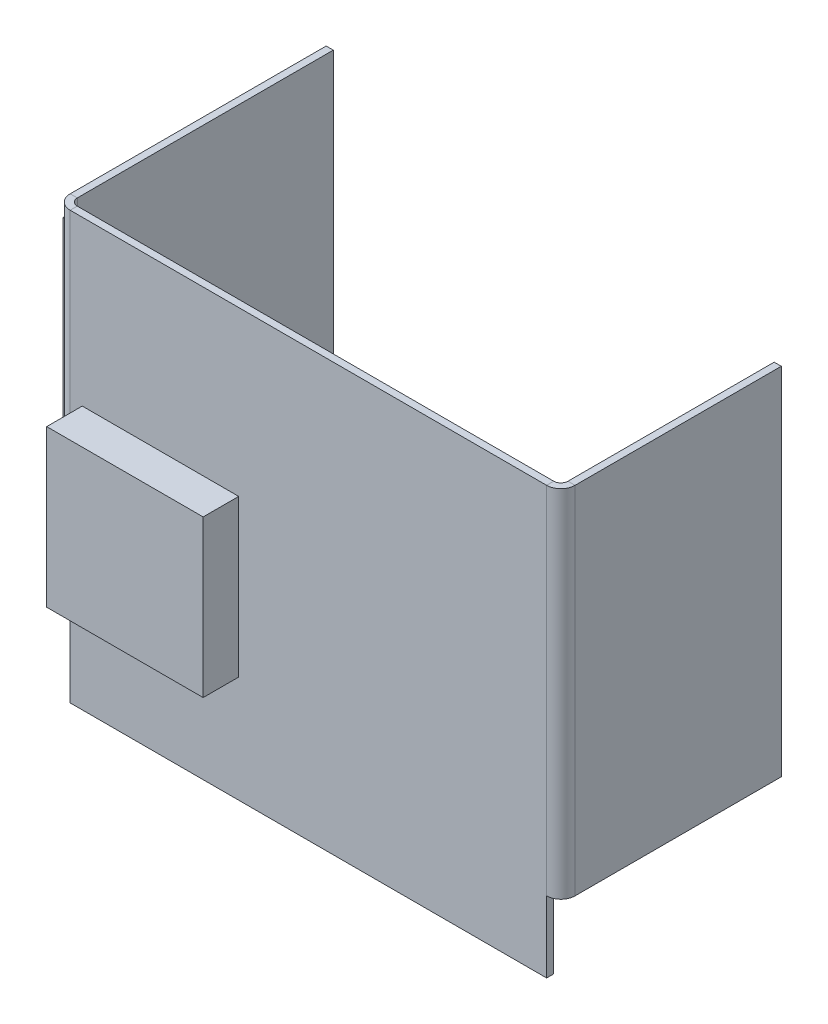
from build123d import *

# Parameters (mm, degrees)
BASE_FLANGE3_DEPTH  = 6
SKETCH14_W          = 0.2
SKETCH14_H          = 1
CUT_EXTRUDE1_DEPTH  = 10.97196069
SKETCH15_W          = 2.2
SKETCH15_H          = 2.2
BOSS_EXTRUDE1_DEPTH = 0.5
SKETCH16_W          = 3
SKETCH16_H          = 4.2
BOSS_EXTRUDE2_DEPTH = 0.5


# Sheet-metal steps are written as plain solids
with BuildPart() as part:
    # Sketch1 → Base-Flange3 (new body)
    with BuildSketch(Plane(origin=(0, 0, 0), x_dir=(1, 0, 0), z_dir=(0, 1, 0))):
        with BuildLine():
            Line((6.9, 3), (6.9, 0.1))
            ThreePointArc((6.9, 0.1), (6.870710678, 0.029289322), (6.8, 0))
            Line((6.8, 0), (0.1, 0))
            ThreePointArc((0.1, 0), (0.029289322, 0.029289322), (0, 0.1))
            Line((0, 0.1), (0, 3.7))
            Line((0, 3.7), (-0.1, 3.7))
            Line((-0.1, 3.7), (-0.1, 0.1))
            ThreePointArc((-0.1, 0.1), (-0.041421356, -0.041421356), (0.1, -0.1))
            Line((0.1, -0.1), (6.8, -0.1))
            ThreePointArc((6.8, -0.1), (6.941421356, -0.041421356), (7, 0.1))
            Line((7, 0.1), (7, 3))
            Line((7, 3), (6.9, 3))
        make_face()
    extrude(amount=BASE_FLANGE3_DEPTH)

    # Sketch14 → Cut-Extrude1 (cut, through all)
    with BuildSketch(Plane.XY.offset(0.1)):
        with Locations((0, 0.5)):
            Rectangle(SKETCH14_W, SKETCH14_H)
        with Locations((6.9, 0.5)):
            Rectangle(SKETCH14_W, SKETCH14_H)
    extrude(amount=-CUT_EXTRUDE1_DEPTH, mode=Mode.SUBTRACT)

    # Sketch15 → Boss-Extrude1 (add)
    with BuildSketch(Plane.XY.offset(0.1)):
        with Locations((1.369926131, 2.6)):
            Rectangle(SKETCH15_W, SKETCH15_H)
    extrude(amount=BOSS_EXTRUDE1_DEPTH)

    # Sketch16 → Boss-Extrude2 (add)
    with BuildSketch(Plane.ZY.offset(0.1)):
        with Locations((-2, 3.160264221)):
            Rectangle(SKETCH16_W, SKETCH16_H)
    extrude(amount=BOSS_EXTRUDE2_DEPTH)


solid = part.part
